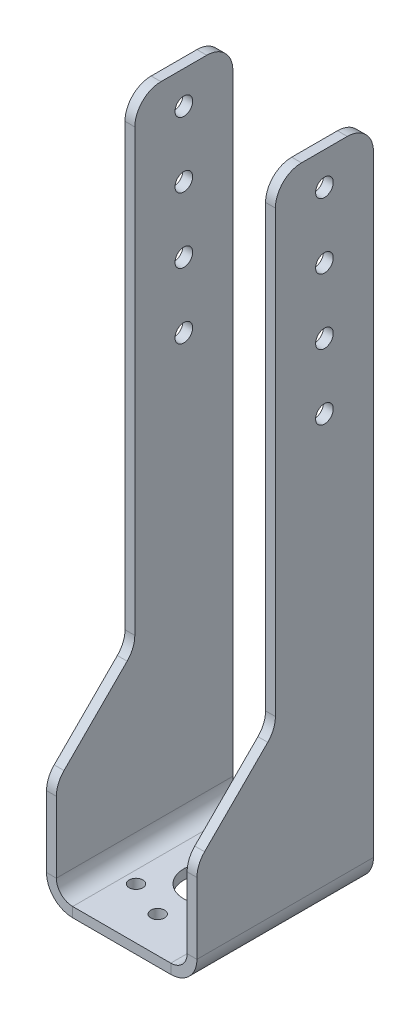
from build123d import *

# Parameters (mm, degrees)
BASE_FLANGE1_DEPTH      = 13.5
SKETCH5_R               = 4
SKETCH5_R_2             = 1.05
CUT_EXTRUDE1_DEPTH      = 10
CUT_EXTRUDE2_DEPTH      = 102.5603269
CUT_EXTRUDE2_DEPTH_BACK = 102.5603269
CUT_EXTRUDE3_DEPTH      = 104.495168969
CUT_EXTRUDE3_DEPTH_BACK = 104.495168969
SKETCH7_R               = 1.35
FILLET1_R               = 4


# Sheet-metal steps are written as plain solids
with BuildPart() as part:
    # Sketch1 → Base-Flange1 (new, symmetric)
    with BuildSketch(Plane.XY):
        with BuildLine():
            Line((-10, 100), (-10, 2.5))
            ThreePointArc((-10, 2.5), (-9.267766953, 0.732233047), (-7.5, 0))
            Line((-7.5, 0), (7.5, 0))
            ThreePointArc((7.5, 0), (9.267766953, 0.732233047), (10, 2.5))
            Line((10, 2.5), (10, 100))
            Line((10, 100), (11.5, 100))
            Line((11.5, 100), (11.5, 2.5))
            ThreePointArc((11.5, 2.5), (10.328427125, -0.328427125), (7.5, -1.5))
            Line((7.5, -1.5), (-7.5, -1.5))
            ThreePointArc((-7.5, -1.5), (-10.328427125, -0.328427125), (-11.5, 2.5))
            Line((-11.5, 2.5), (-11.5, 100))
            Line((-11.5, 100), (-10, 100))
        make_face()
    extrude(amount=BASE_FLANGE1_DEPTH, both=True)

    # Sketch5 → Cut-Extrude1 (cut)
    with BuildSketch(Plane(origin=(0, 0, 0), x_dir=(1, 0, 0), z_dir=(0, 1, 0))):
        with Locations(Location((0, 0, 0), (0, 0, 270))):
            Circle(SKETCH5_R)
        with Locations(Location((-5.656854249, 5.656854249, 0), (0, 0, 270))):
            Circle(SKETCH5_R_2)
        with Locations(Location((0, 8, 0), (0, 0, 270))):
            Circle(SKETCH5_R_2)
        with Locations(Location((5.656854249, 5.656854249, 0), (0, 0, 270))):
            Circle(SKETCH5_R_2)
        with Locations(Location((5.656854249, -5.656854249, 0), (0, 0, 270))):
            Circle(SKETCH5_R_2)
        with Locations(Location((0, -8, 0), (0, 0, 270))):
            Circle(SKETCH5_R_2)
        with Locations(Location((-5.656854249, -5.656854249, 0), (0, 0, 270))):
            Circle(SKETCH5_R_2)
    extrude(amount=-CUT_EXTRUDE1_DEPTH, mode=Mode.SUBTRACT)

    # Sketch6 → Cut-Extrude2 (cut, two sides: drawn at the far end of the back side and taken through both)
    with BuildSketch(Plane(origin=(0, 0, 0), x_dir=(0, 0, -1), z_dir=(1, 0, 0)).offset(-CUT_EXTRUDE2_DEPTH_BACK)):
        Polygon((-1.5, 100), (-1.5, 27), (-13.5, 15), (-13.5, 100), align=None)
    extrude(amount=CUT_EXTRUDE2_DEPTH + CUT_EXTRUDE2_DEPTH_BACK, mode=Mode.SUBTRACT)

    # Sketch7 → Cut-Extrude3 (cut, two sides: drawn at the far end of the back side and taken through both)
    with BuildSketch(Plane(origin=(11.5, 0, 0), x_dir=(0, 0, -1), z_dir=(1, 0, 0)).offset(-CUT_EXTRUDE3_DEPTH_BACK)):
        with Locations(Location((6, 95, 0), (0, 0, 90))):
            Circle(SKETCH7_R)
        with Locations(Location((6, 85, 0), (0, 0, 90))):
            Circle(SKETCH7_R)
        with Locations(Location((6, 75, 0), (0, 0, 90))):
            Circle(SKETCH7_R)
        with Locations(Location((6, 65, 0), (0, 0, 90))):
            Circle(SKETCH7_R)
    extrude(amount=CUT_EXTRUDE3_DEPTH + CUT_EXTRUDE3_DEPTH_BACK, mode=Mode.SUBTRACT)

    # Fillet1
    fillet1_edges = [part.edges().sort_by_distance(p)[0] for p in [
        (-10.75, 27, 1.5),
        (-10.75, 100, 1.5),
        (-10.75, 15, 13.5),
        (-10.75, 100, -13.5),
        (10.75, 27, 1.5),
        (10.75, 15, 13.5),
        (10.75, 100, 1.5),
        (10.75, 100, -13.5),
    ]]
    fillet(fillet1_edges, radius=FILLET1_R)


solid = part.part
